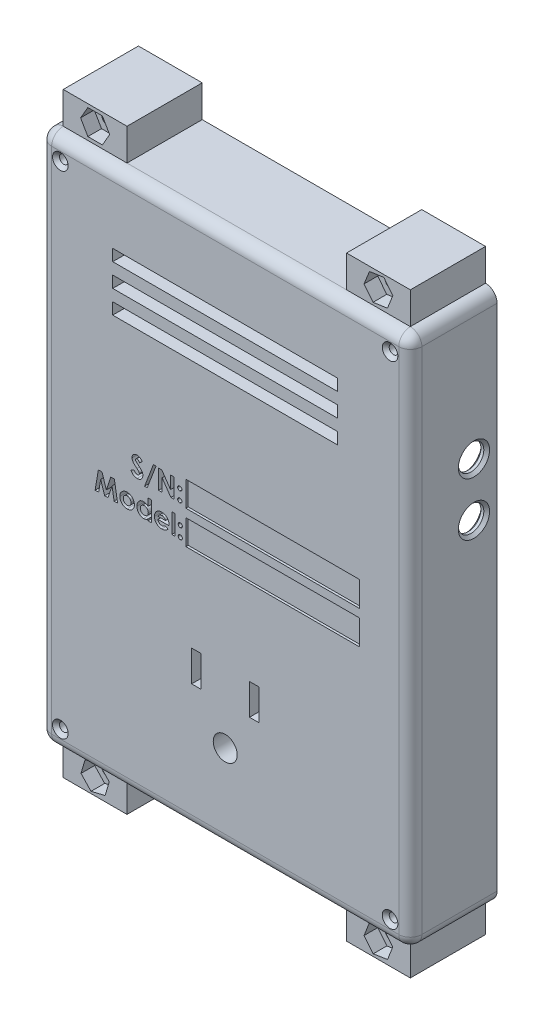
from build123d import *

# Parameters (mm, degrees)
SKETCH5_W                   = 81.28
SKETCH5_H                   = 116.84
CASE_2_DEPTH                = 12.7
CASE_CUT_DEPTH              = 7.366
SKETCH13_R                  = 2.159
BOARD_MOUNT_DEPTH           = 2.54
SKETCH11_R                  = 0.8255
BOARD_MOUNT_SCREW_CUT_DEPTH = 5.588
SKETCH8_R                   = 0.9525
FACEPLATE_SCREW_CUT_DEPTH   = 73.289667311
SKETCH14_R                  = 2.6289
SKETCH14_W                  = 2.032
SKETCH14_H                  = 6.8072
OUTLET_CUT_DEPTH            = 72.545537639
SKETCH24_W                  = 81.28
SKETCH24_H                  = 116.84
BOSS_EXTRUDE1_DEPTH         = 6.35
CUT_EXTRUDE1_START          = -6.35
CUT_EXTRUDE1_DEPTH          = 6.35
FILLET11_R                  = 2.54
FILLET12_R                  = 2.54
FILLET13_R                  = 2.54
SKETCH28_R                  = 0.9525
CUT_EXTRUDE3_DEPTH          = 73.289667311
FILLET14_R                  = 2.54
SKETCH30_W                  = 79.248
SKETCH30_H                  = 114.808
CUT_EXTRUDE4_DEPTH          = 2.032
FILLET15_R                  = 2.54
FILLET16_R                  = 2.54
FILLET17_R                  = 2.54
FILLET18_R                  = 2.54
SKETCH18_R                  = 2.794
CUT_EXTRUDE5_DEPTH          = 2.54
CHAMFER6_SIZE               = 0.635
FILLET19_R                  = 2.54
CHAMFER7_SIZE               = 0.762
SKETCH31_W                  = 38.071387925
SKETCH31_H                  = 5.512590528
SKETCH31_H_2                = 5.504700738
CUT_EXTRUDE6_DEPTH          = 0.508
SKETCH32_W                  = 0.75982906
SKETCH32_H                  = 4.341880342
CUT_EXTRUDE7_DEPTH          = 1.905
SKETCH33_W                  = 49.388401948
SKETCH33_H                  = 2.54
CUT_EXTRUDE8_DEPTH          = 27.94
SKETCH34_W                  = 14
SKETCH34_H                  = 16.51
BOSS_EXTRUDE2_DEPTH         = 7
SKETCH35_W                  = 14
SKETCH35_H                  = 16.51
BOSS_EXTRUDE3_DEPTH         = 7
SKETCH36_R                  = 1.575
CUT_EXTRUDE9_DEPTH          = 16.51
CUT_EXTRUDE10_DEPTH         = 3


with BuildPart() as part:
    # Sketch5 → Case 2 (new body)
    with BuildSketch(Plane.XY):
        Rectangle(SKETCH5_W, SKETCH5_H)
    extrude(amount=CASE_2_DEPTH)

    # Sketch4 → Case Cut (cut)
    with BuildSketch(Plane.XY):
        with BuildLine():
            Line((-36.195, 56.515), (36.195, 56.515))
            ThreePointArc((36.195, 56.515), (34.398948776, 52.178948776), (38.735, 53.975))
            Line((38.735, 53.975), (38.735, -53.975))
            ThreePointArc((38.735, -53.975), (34.398948776, -52.178948776), (36.195, -56.515))
            Line((36.195, -56.515), (-36.195, -56.515))
            ThreePointArc((-36.195, -56.515), (-34.398948776, -52.178948776), (-38.735, -53.975))
            Line((-38.735, -53.975), (-38.735, 53.975))
            ThreePointArc((-38.735, 53.975), (-34.398948776, 52.178948776), (-36.195, 56.515))
        make_face()
    extrude(amount=CASE_CUT_DEPTH, mode=Mode.SUBTRACT)

    # Sketch13 → Board Mount (add)
    with BuildSketch(Plane(origin=(0, 0, 7.366), x_dir=(-1, 0, 0), z_dir=(0, 0, -1))):
        with Locations(Location((-35.56, 48.641, 0), (0, 0, 180))):
            Circle(SKETCH13_R)
        with Locations(Location((35.56, 48.641, 0), (0, 0, 180))):
            Circle(SKETCH13_R)
        with Locations(Location((-35.56, -48.641, 0), (0, 0, 180))):
            Circle(SKETCH13_R)
        with Locations(Location((35.56, -48.641, 0), (0, 0, 180))):
            Circle(SKETCH13_R)
    extrude(amount=BOARD_MOUNT_DEPTH)

    # Sketch11 → Board Mount Screw Cut (cut)
    with BuildSketch(Plane(origin=(0, 0, 7.366), x_dir=(-1, 0, 0), z_dir=(0, 0, -1))):
        with Locations((-35.56, 48.641)):
            Circle(SKETCH11_R)
        with Locations((35.56, 48.641)):
            Circle(SKETCH11_R)
        with Locations((35.56, -48.641)):
            Circle(SKETCH11_R)
        with Locations((-35.56, -48.641)):
            Circle(SKETCH11_R)
    extrude(amount=BOARD_MOUNT_SCREW_CUT_DEPTH, mode=Mode.SUBTRACT)

    # Sketch8 → FacePlate Screw Cut (cut, through all)
    with BuildSketch(Plane.XY):
        with Locations((-36.195, 53.975)):
            Circle(SKETCH8_R)
        with Locations((-36.195, -53.975)):
            Circle(SKETCH8_R)
        with Locations((36.195, 53.975)):
            Circle(SKETCH8_R)
        with Locations((36.195, -53.975)):
            Circle(SKETCH8_R)
    extrude(amount=FACEPLATE_SCREW_CUT_DEPTH, mode=Mode.SUBTRACT)

    # Sketch14 → Outlet Cut (cut, through all)
    with BuildSketch(Plane(origin=(0, 0, 7.366), x_dir=(-1, 0, 0), z_dir=(0, 0, -1))):
        with Locations((0, -39.497)):
            Circle(SKETCH14_R)
        with Locations((-6.35, -27.559)):
            Rectangle(SKETCH14_W, SKETCH14_H)
        with Locations((6.35, -27.559)):
            Rectangle(SKETCH14_W, SKETCH14_H)
    extrude(amount=-OUTLET_CUT_DEPTH, mode=Mode.SUBTRACT)

    # Sketch24 → Boss-Extrude1 (add)
    with BuildSketch(Plane.XY):
        Rectangle(SKETCH24_W, SKETCH24_H)
    extrude(amount=-BOSS_EXTRUDE1_DEPTH)

    # Sketch26 → Cut-Extrude1 (cut)
    with BuildSketch(Plane.XY.offset(CUT_EXTRUDE1_START)):
        with BuildLine():
            Line((-36.195, 56.515), (36.195, 56.515))
            ThreePointArc((36.195, 56.515), (34.398948776, 52.178948776), (38.735, 53.975))
            Line((38.735, 53.975), (38.735, -53.975))
            ThreePointArc((38.735, -53.975), (34.398948776, -52.178948776), (36.195, -56.515))
            Line((36.195, -56.515), (-36.195, -56.515))
            ThreePointArc((-36.195, -56.515), (-34.398948776, -52.178948776), (-38.735, -53.975))
            Line((-38.735, -53.975), (-38.735, 53.975))
            ThreePointArc((-38.735, 53.975), (-34.398948776, 52.178948776), (-36.195, 56.515))
        make_face()
    extrude(amount=CUT_EXTRUDE1_DEPTH, mode=Mode.SUBTRACT)

    # Fillet11
    fillet11_edges = [part.edges().sort_by_distance(p)[0] for p in [
        (40.64, -58.42, 3.175),
    ]]
    fillet(fillet11_edges, radius=FILLET11_R)

    # Fillet12
    fillet12_edges = [part.edges().sort_by_distance(p)[0] for p in [
        (40.64, 58.42, 3.175),
    ]]
    fillet(fillet12_edges, radius=FILLET12_R)

    # Fillet13
    fillet13_edges = [part.edges().sort_by_distance(p)[0] for p in [
        (-40.64, 58.42, 3.175),
    ]]
    fillet(fillet13_edges, radius=FILLET13_R)

    # Sketch28 → Cut-Extrude3 (cut, through all)
    with BuildSketch(Plane(origin=(0, 0, 0), x_dir=(-1, 0, 0), z_dir=(0, 0, -1))):
        with Locations((-36.195, 53.975)):
            Circle(SKETCH28_R)
        with Locations((-36.195, -53.975)):
            Circle(SKETCH28_R)
        with Locations((36.195, 53.975)):
            Circle(SKETCH28_R)
        with Locations((36.195, -53.975)):
            Circle(SKETCH28_R)
    extrude(amount=CUT_EXTRUDE3_DEPTH, mode=Mode.SUBTRACT)

    # Fillet14
    fillet14_edges = [part.edges().sort_by_distance(p)[0] for p in [
        (-40.64, -58.42, 3.175),
    ]]
    fillet(fillet14_edges, radius=FILLET14_R)

    # Sketch30 → Cut-Extrude4 (cut)
    with BuildSketch(Plane(origin=(0, 0, -6.35), x_dir=(-1, 0, 0), z_dir=(0, 0, -1))):
        Rectangle(SKETCH30_W, SKETCH30_H)
    extrude(amount=-CUT_EXTRUDE4_DEPTH, mode=Mode.SUBTRACT)

    # Fillet15
    fillet15_edges = [part.edges().sort_by_distance(p)[0] for p in [
        (39.624, 57.404, -5.334),
    ]]
    fillet(fillet15_edges, radius=FILLET15_R)

    # Fillet16
    fillet16_edges = [part.edges().sort_by_distance(p)[0] for p in [
        (-39.624, 57.404, -5.334),
    ]]
    fillet(fillet16_edges, radius=FILLET16_R)

    # Fillet17
    fillet17_edges = [part.edges().sort_by_distance(p)[0] for p in [
        (-39.624, -57.404, -5.334),
    ]]
    fillet(fillet17_edges, radius=FILLET17_R)

    # Fillet18
    fillet18_edges = [part.edges().sort_by_distance(p)[0] for p in [
        (39.624, -57.404, -5.334),
    ]]
    fillet(fillet18_edges, radius=FILLET18_R)

    # Sketch18 → Cut-Extrude5 (cut)
    with BuildSketch(Plane(origin=(40.64, 0, 0), x_dir=(0, 0, -1), z_dir=(1, 0, 0))):
        with Locations((1.27, 28.829)):
            Circle(SKETCH18_R)
        with Locations((1.27, 17.145)):
            Circle(SKETCH18_R)
    extrude(amount=-CUT_EXTRUDE5_DEPTH, mode=Mode.SUBTRACT)

    # Chamfer6
    # the kernel refuses this chamfer: 0.635 mm, written as the material it takes off along each edge
    with BuildSketch(Plane(origin=(38.735, 28.829, -1.27), x_dir=(0, 0, -1), z_dir=(0, -1, 0))) as chamfer6_piece_1:
        Polygon((2.794, CHAMFER6_SIZE), (2.794 + CHAMFER6_SIZE, 0), (2.794, 0), align=None)
    revolve(axis=Axis((38.735, 28.829, -1.27), (1, 0, 0)), mode=Mode.SUBTRACT)
    with BuildSketch(Plane(origin=(40.64, 28.829, -1.27), x_dir=(0, 0, -1), z_dir=(0, -1, 0))) as chamfer6_piece_2:
        Polygon((2.794 + CHAMFER6_SIZE, 0), (2.794, -CHAMFER6_SIZE), (2.794, 0), align=None)
    revolve(axis=Axis((40.64, 28.829, -1.27), (1, 0, 0)), mode=Mode.SUBTRACT)
    with BuildSketch(Plane(origin=(38.735, 17.145, -1.27), x_dir=(0, 0, -1), z_dir=(0, -1, 0))) as chamfer6_piece_3:
        Polygon((2.794, CHAMFER6_SIZE), (2.794 + CHAMFER6_SIZE, 0), (2.794, 0), align=None)
    revolve(axis=Axis((38.735, 17.145, -1.27), (1, 0, 0)), mode=Mode.SUBTRACT)
    with BuildSketch(Plane(origin=(40.64, 17.145, -1.27), x_dir=(0, 0, -1), z_dir=(0, -1, 0))) as chamfer6_piece_4:
        Polygon((2.794 + CHAMFER6_SIZE, 0), (2.794, -CHAMFER6_SIZE), (2.794, 0), align=None)
    revolve(axis=Axis((40.64, 17.145, -1.27), (1, 0, 0)), mode=Mode.SUBTRACT)

    # Fillet19
    fillet19_edges = [part.edges().sort_by_distance(p)[0] for p in [
        (40.64, 0, 12.7),
        (39.896051224, -57.676051224, 12.7),
        (0, 58.42, 12.7),
        (39.896051224, 57.676051224, 12.7),
        (-40.64, 0, 12.7),
        (-39.896051224, 57.676051224, 12.7),
        (0, -58.42, 12.7),
        (-39.896051224, -57.676051224, 12.7),
    ]]
    fillet(fillet19_edges, radius=FILLET19_R)

    # Chamfer7
    chamfer7_edges = [part.edges().sort_by_distance(p)[0] for p in [
        (-37.1475, 53.975, 12.7),
        (-37.1475, -53.975, 12.7),
        (35.2425, 53.975, 12.7),
        (35.2425, -53.975, 12.7),
    ]]
    chamfer(chamfer7_edges, length=CHAMFER7_SIZE)

    # Sketch31 → Cut-Extrude6 (cut)
    with BuildSketch(Plane.XY.offset(12.7)):
        with Locations((10.393000027, 4.552836284)):
            Rectangle(SKETCH31_W, SKETCH31_H)
        with Locations((10.393000027, -2.752350369)):
            Rectangle(SKETCH31_W, SKETCH31_H_2)
    extrude(amount=-CUT_EXTRUDE6_DEPTH, mode=Mode.SUBTRACT)

    # Sketch32 → Cut-Extrude7 (cut)
    # profile 1 of 12: a face of its own
    with BuildSketch(Plane.XY.offset(12.7)):
        with BuildLine():
            Line((-18.191123097, 5.877144928), (-18.759298845, 5.35730652))
            add(Edge.make_bspline(
                [(-18.759298845, 5.35730652), (-18.783637058, 5.3916381), (-18.830363032, 5.457549944), (-18.906100963, 5.545807458), (-18.981496898, 5.621097685), (-19.057249335, 5.683106097), (-19.134029715, 5.731455949), (-19.211704758, 5.765688177), (-19.289834103, 5.78744993), (-19.342324962, 5.790159792), (-19.368179721, 5.791494554)],
                knots=[0, 0, 0, 0, 1.299362458, 2.494594718, 3.587462134, 4.587049575, 5.512617175, 6.380583204, 7.202344345, 8, 8, 8, 8], degree=3))
            add(Edge.make_bspline(
                [(-19.368179721, 5.791494554), (-19.392296298, 5.790648788), (-19.438859073, 5.789015835), (-19.505237763, 5.772784401), (-19.564169709, 5.744771331), (-19.615597397, 5.708141885), (-19.656335713, 5.664011895), (-19.688862099, 5.617730882), (-19.707177188, 5.56664711), (-19.709587814, 5.531560715), (-19.710781217, 5.514190869)],
                knots=[0, 0, 0, 0, 1.185010067, 2.2879431, 3.333075148, 4.379039566, 5.372662701, 6.27520591, 7.14612461, 8, 8, 8, 8], degree=3))
            add(Edge.make_bspline(
                [(-19.710781217, 5.514190869), (-19.710033372, 5.496570541), (-19.708527316, 5.461085649), (-19.693980864, 5.409078121), (-19.672055208, 5.358260713), (-19.651104348, 5.327325738), (-19.640395266, 5.311513251)],
                knots=[0, 0, 0, 0, 0.967525499, 1.948461899, 2.951351359, 4, 4, 4, 4], degree=3))
            add(Edge.make_bspline(
                [(-19.640395266, 5.311513251), (-19.630659552, 5.29922237), (-19.608249223, 5.270930386), (-19.565517316, 5.226120294), (-19.511855016, 5.171224009), (-19.445197284, 5.108129253), (-19.368311265, 5.034566892), (-19.277633194, 4.95342869), (-19.175773181, 4.862201892), (-19.103373444, 4.798674854), (-19.06543533, 4.765386114)],
                knots=[0, 0, 0, 0, 0.473873513, 1.090794244, 1.870441696, 2.795289791, 3.865433203, 5.087734844, 6.473946851, 8, 8, 8, 8], degree=3))
            add(Edge.make_bspline(
                [(-19.06543533, 4.765386114), (-19.029824953, 4.734567129), (-18.962243855, 4.676079098), (-18.866089373, 4.593064728), (-18.781585599, 4.518378724), (-18.707501503, 4.453141963), (-18.64496013, 4.396669961), (-18.593698554, 4.348692783), (-18.553090703, 4.310144456), (-18.530007518, 4.286861243), (-18.520156217, 4.276924576)],
                knots=[0, 0, 0, 0, 1.543621617, 2.929473131, 4.163658386, 5.240097082, 6.164993805, 6.925417477, 7.541396219, 8, 8, 8, 8], degree=3))
            add(Edge.make_bspline(
                [(-18.520156217, 4.276924576), (-18.482782434, 4.236478138), (-18.410936897, 4.158725881), (-18.317563027, 4.038234335), (-18.240713312, 3.920610017), (-18.181260915, 3.803639635), (-18.136360074, 3.685635539), (-18.104704386, 3.563703686), (-18.085745583, 3.436569964), (-18.083640714, 3.349816718), (-18.082576089, 3.305937663)],
                knots=[0, 0, 0, 0, 1.206664779, 2.319633467, 3.337109185, 4.282041471, 5.190008762, 6.099243693, 7.03861361, 8, 8, 8, 8], degree=3))
            add(Edge.make_bspline(
                [(-18.082576089, 3.305937663), (-18.083333861, 3.263182906), (-18.08482064, 3.179296481), (-18.103030829, 3.056541193), (-18.128997489, 2.939059055), (-18.1691465, 2.828128438), (-18.218079878, 2.721928451), (-18.279424934, 2.622113351), (-18.351466291, 2.527672968), (-18.434036748, 2.440295541), (-18.525369477, 2.361006582), (-18.62333251, 2.290421678), (-18.728883778, 2.232144849), (-18.841121467, 2.184158037), (-18.959985499, 2.147197952), (-19.085334271, 2.119881006), (-19.217359513, 2.103485805), (-19.307640277, 2.101771881), (-19.353763321, 2.100896264)],
                knots=[0, 0, 0, 0, 1.043214005, 2.046824704, 3.02475056, 3.976699089, 4.921714032, 5.875962561, 6.831408892, 7.817874052, 8.806269674, 9.781291748, 10.760897367, 11.74438705, 12.757449933, 13.795994037, 14.874007457, 16, 16, 16, 16], degree=3))
            add(Edge.make_bspline(
                [(-19.353763321, 2.100896264), (-19.389969519, 2.101538586), (-19.461678554, 2.102810752), (-19.567366831, 2.113196929), (-19.66942081, 2.129959113), (-19.767725536, 2.153984331), (-19.862723889, 2.184427541), (-19.954419771, 2.221612755), (-20.042180175, 2.266116331), (-20.126669137, 2.317023097), (-20.207475937, 2.376132559), (-20.285622345, 2.442236243), (-20.360332136, 2.516350852), (-20.431964128, 2.598301108), (-20.500059997, 2.688319076), (-20.566848767, 2.785151087), (-20.629362144, 2.890594214), (-20.667979437, 2.96456342), (-20.687704294, 3.002345249)],
                knots=[0, 0, 0, 0, 1.016823716, 2.013894106, 2.979844003, 3.91962641, 4.853723003, 5.779685073, 6.695824784, 7.614987388, 8.547259901, 9.504950863, 10.487499108, 11.500346958, 12.559593716, 13.656357062, 14.802919212, 16, 16, 16, 16], degree=3))
            Line((-20.687704294, 3.002345249), (-20.019461772, 3.403460366))
            add(Edge.make_bspline(
                [(-20.019461772, 3.403460366), (-19.994788925, 3.360573054), (-19.947488968, 3.278354412), (-19.86733477, 3.167883246), (-19.785220886, 3.073282978), (-19.699248916, 2.996225674), (-19.610464248, 2.93568098), (-19.518438031, 2.892411542), (-19.423105609, 2.865627808), (-19.358169495, 2.862356896), (-19.325778546, 2.860725324)],
                knots=[0, 0, 0, 0, 1.283663364, 2.460892379, 3.537111102, 4.529833553, 5.449777664, 6.316464042, 7.160231139, 8, 8, 8, 8], degree=3))
            add(Edge.make_bspline(
                [(-19.325778546, 2.860725324), (-19.292832314, 2.862057754), (-19.228911825, 2.864642863), (-19.137673506, 2.888520734), (-19.054022761, 2.926010744), (-18.981715675, 2.979503818), (-18.920490593, 3.041242955), (-18.875302969, 3.109930569), (-18.846915798, 3.184248909), (-18.843914586, 3.235875316), (-18.842405148, 3.261840441)],
                knots=[0, 0, 0, 0, 1.13588714, 2.203786484, 3.234766741, 4.283437687, 5.291419208, 6.222934724, 7.106237994, 8, 8, 8, 8], degree=3))
            add(Edge.make_bspline(
                [(-18.842405148, 3.261840441), (-18.843799052, 3.285996764), (-18.846630635, 3.335068022), (-18.867487199, 3.408029092), (-18.90009237, 3.480956981), (-18.938666586, 3.540774409), (-18.977920682, 3.590857919), (-19.015456451, 3.634253015), (-19.061165088, 3.682197), (-19.114930696, 3.734750182), (-19.176042892, 3.792375201), (-19.244553154, 3.855066414), (-19.321245998, 3.922271587), (-19.375452651, 3.968051086), (-19.403796708, 3.991988678)],
                knots=[0, 0, 0, 0, 0.916159276, 1.861089862, 2.860218735, 3.940849679, 4.552606315, 5.27541173, 6.11797699, 7.06649574, 8.129236253, 9.306560635, 10.591630461, 12, 12, 12, 12], degree=3))
            add(Edge.make_bspline(
                [(-19.403796708, 3.991988678), (-19.457679889, 4.037579016), (-19.561098022, 4.125080674), (-19.707240965, 4.254317867), (-19.838928842, 4.375101866), (-19.955024255, 4.488925826), (-20.057006439, 4.59368768), (-20.144184727, 4.690238346), (-20.215601426, 4.779322579), (-20.290752102, 4.884836891), (-20.362160269, 5.013413331), (-20.42387719, 5.168105694), (-20.463916523, 5.322778428), (-20.468402374, 5.426617183), (-20.470610277, 5.477725858)],
                knots=[0, 0, 0, 0, 1.345494975, 2.582412109, 3.71882943, 4.751509156, 5.681369928, 6.505683931, 7.230279997, 7.856715994, 8.973648664, 10.023341002, 11.027102913, 12, 12, 12, 12], degree=3))
            add(Edge.make_bspline(
                [(-20.470610277, 5.477725858), (-20.469692013, 5.513969387), (-20.467882934, 5.585373032), (-20.451745677, 5.690361689), (-20.42762793, 5.791666921), (-20.392602038, 5.888919121), (-20.347142659, 5.981996477), (-20.29193401, 6.071354641), (-20.226118803, 6.156171181), (-20.151949509, 6.236389869), (-20.070233936, 6.309700622), (-19.982910462, 6.374404707), (-19.890473345, 6.429054718), (-19.793488069, 6.47439087), (-19.691353656, 6.509092815), (-19.584822526, 6.533691283), (-19.47374188, 6.548321668), (-19.398187222, 6.550310499), (-19.359699486, 6.551323614)],
                knots=[0, 0, 0, 0, 1.010766082, 1.991317756, 2.957454644, 3.913069143, 4.869106762, 5.843196583, 6.838735724, 7.860187025, 8.887984031, 9.89767229, 10.887916223, 11.879572884, 12.879850636, 13.892031539, 14.926195476, 16, 16, 16, 16], degree=3))
            add(Edge.make_bspline(
                [(-19.359699486, 6.551323614), (-19.309821285, 6.549498963), (-19.210458604, 6.545864065), (-19.063548015, 6.517440346), (-18.920051894, 6.472741054), (-18.80442003, 6.418816276), (-18.712413914, 6.366579318), (-18.641899821, 6.318486107), (-18.570147936, 6.263392749), (-18.496579624, 6.201125631), (-18.422561899, 6.130511557), (-18.345990082, 6.053231552), (-18.267907559, 5.968617736), (-18.217166299, 5.908170018), (-18.191123097, 5.877144928)],
                knots=[0, 0, 0, 0, 1.282922637, 2.555718331, 3.837320111, 5.142675274, 5.830281639, 6.55870424, 7.337177975, 8.157850921, 9.037902056, 9.96903443, 10.957596896, 12, 12, 12, 12], degree=3))
        make_face()
    # profile 2 of 12: a face of its own
    with BuildSketch(Plane.XY.offset(12.7)):
        Polygon((-17.702661559, 1.449614213), (-15.754751569, 6.551323614), (-15.17894361, 6.551323614), (-17.126853599, 1.449614213), align=None)
    # profile 3 of 12: a face of its own
    with BuildSketch(Plane.XY.offset(12.7)):
        Polygon((-14.609071815, 6.442776606), (-13.924716847, 6.442776606), (-12.00394361, 3.657019394), (-12.00394361, 6.442776606), (-11.24411455, 6.442776606), (-11.24411455, 2.209443272), (-11.933557659, 2.209443272), (-13.849242755, 4.986720249), (-13.849242755, 2.209443272), (-14.609071815, 2.209443272), align=None)
    # profile 4 of 12: a face of its own
    with BuildSketch(Plane.XY.offset(12.7)):
        with BuildLine():
            add(Edge.make_bspline(
                [(-9.9686872, 5.35730652), (-9.937984768, 5.355718732), (-9.87745762, 5.352588546), (-9.790545469, 5.326478209), (-9.711335748, 5.282486162), (-9.641172065, 5.223512547), (-9.581903266, 5.153199943), (-9.538407615, 5.073439373), (-9.511958455, 4.986110206), (-9.508913781, 4.925280522), (-9.507362413, 4.894285687)],
                knots=[0, 0, 0, 0, 1.013817282, 1.998651736, 2.969187861, 3.991244904, 5.013301947, 5.9920405, 6.976874954, 8, 8, 8, 8], degree=3))
            add(Edge.make_bspline(
                [(-9.507362413, 4.894285687), (-9.508893514, 4.863843269), (-9.511898432, 4.804097377), (-9.538799386, 4.718083569), (-9.581866264, 4.638752833), (-9.641182178, 4.568453843), (-9.711333192, 4.509476568), (-9.790546146, 4.465485454), (-9.877457444, 4.439374871), (-9.937984709, 4.436244719), (-9.9686872, 4.434656948)],
                knots=[0, 0, 0, 0, 1.009116963, 1.980479832, 2.963706907, 3.990451133, 5.017195359, 5.992182391, 6.981533323, 8, 8, 8, 8], degree=3))
            add(Edge.make_bspline(
                [(-9.9686872, 4.434656948), (-9.99940554, 4.436214655), (-10.059964051, 4.43928554), (-10.146757405, 4.465862547), (-10.226762822, 4.508213247), (-10.296884149, 4.566824871), (-10.356742443, 4.636055979), (-10.398546924, 4.716040624), (-10.425601169, 4.802663802), (-10.428518728, 4.863267593), (-10.430011986, 4.894285687)],
                knots=[0, 0, 0, 0, 1.016706445, 2.004347467, 2.981433789, 4.000427929, 5.018214116, 5.995300439, 6.973959266, 8, 8, 8, 8], degree=3))
            add(Edge.make_bspline(
                [(-10.430011986, 4.894285687), (-10.428481289, 4.92529182), (-10.425477182, 4.986143677), (-10.398772747, 5.073182383), (-10.35649654, 5.15345188), (-10.296961165, 5.223440376), (-10.226780242, 5.282779937), (-10.146985625, 5.326258075), (-10.059938403, 5.352626918), (-9.999396909, 5.355731645), (-9.9686872, 5.35730652)],
                knots=[0, 0, 0, 0, 1.022642663, 2.007012786, 2.980863166, 4.002438329, 5.024013493, 6.00229059, 6.986660713, 8, 8, 8, 8], degree=3))
        make_face()
    # profile 5 of 12: a face of its own
    with BuildSketch(Plane.XY.offset(12.7)):
        with BuildLine():
            add(Edge.make_bspline(
                [(-9.9686872, 3.077819341), (-9.938013801, 3.076137592), (-9.877623178, 3.072826519), (-9.790366961, 3.048116329), (-9.711617723, 3.003720953), (-9.641205382, 2.945814879), (-9.581666479, 2.87614614), (-9.538633107, 2.796697462), (-9.511835147, 2.709777455), (-9.508876633, 2.649196835), (-9.507362413, 2.618190601)],
                knots=[0, 0, 0, 0, 1.016957001, 2.002212695, 2.9757545, 3.99499976, 5.013036768, 5.994806404, 6.97370641, 8, 8, 8, 8], degree=3))
            add(Edge.make_bspline(
                [(-9.507362413, 2.618190601), (-9.508866713, 2.587179388), (-9.511805846, 2.526589038), (-9.538818546, 2.439499662), (-9.581602174, 2.359397988), (-9.641210159, 2.288982703), (-9.711326121, 2.229985335), (-9.790548019, 2.185999349), (-9.877456956, 2.159887412), (-9.937984545, 2.156757446), (-9.9686872, 2.155169768)],
                knots=[0, 0, 0, 0, 1.023218912, 1.999186227, 2.986238111, 4.008388923, 5.030539734, 6.0011649, 6.986089706, 8, 8, 8, 8], degree=3))
            add(Edge.make_bspline(
                [(-9.9686872, 2.155169768), (-9.99939713, 2.156744535), (-10.05993906, 2.15984905), (-10.146983091, 2.186219446), (-10.226789867, 2.229691667), (-10.296923446, 2.289054267), (-10.356797733, 2.359148641), (-10.398364982, 2.439752397), (-10.425629298, 2.526556205), (-10.428528251, 2.587168272), (-10.430011986, 2.618190601)],
                knots=[0, 0, 0, 0, 1.013427518, 1.99788335, 2.976245624, 3.997909735, 5.019573847, 6.001765691, 6.977268297, 8, 8, 8, 8], degree=3))
            add(Edge.make_bspline(
                [(-10.430011986, 2.618190601), (-10.428518462, 2.649208145), (-10.425600384, 2.70981086), (-10.398549893, 2.796441816), (-10.356731114, 2.876396841), (-10.296928439, 2.945743166), (-10.226496763, 3.004012328), (-10.147165165, 3.047899247), (-10.059772922, 3.072865165), (-9.999367907, 3.076150609), (-9.9686872, 3.077819341)],
                knots=[0, 0, 0, 0, 1.025808215, 2.00424526, 2.981110158, 3.998665696, 5.017428914, 5.998734231, 6.983523959, 8, 8, 8, 8], degree=3))
        make_face()
    # profile 6 of 12: a face of its own
    with BuildSketch(Plane.XY.offset(12.7)):
        Polygon((-27.846040786, -0.50739833), (-27.057378927, -0.50739833), (-26.091480156, -3.460216172), (-25.118797197, -0.50739833), (-24.337767549, -0.50739833), (-23.622035711, -4.740731663), (-24.39119303, -4.740731663), (-24.843189558, -2.066913554), (-25.723437955, -4.740731663), (-26.464610498, -4.740731663), (-27.339770754, -2.066913554), (-27.790919258, -4.740731663), (-28.5609246, -4.740731663), align=None)
    # profile 7 of 12: a face of its own
    with BuildSketch(Plane.XY.offset(12.7)):
        with BuildLine():
            add(Edge.make_bspline(
                [(-21.551162314, -1.592868415), (-21.515239063, -1.593507694), (-21.444094748, -1.594773756), (-21.338134179, -1.605312564), (-21.234026045, -1.622507064), (-21.131171946, -1.64477094), (-21.030526979, -1.67596596), (-20.931563274, -1.713379563), (-20.833395968, -1.756334754), (-20.738461555, -1.807466457), (-20.646074204, -1.862923452), (-20.558485498, -1.924097067), (-20.476422799, -1.990506806), (-20.398362745, -2.060612905), (-20.32794306, -2.137467555), (-20.260663549, -2.217367578), (-20.200159159, -2.303175512), (-20.14414081, -2.392800416), (-20.094268076, -2.485724008), (-20.050962779, -2.581299876), (-20.013377853, -2.678206618), (-19.983949609, -2.777624624), (-19.959585736, -2.878242935), (-19.9442104, -2.981294553), (-19.933279602, -3.085720881), (-19.932053913, -3.156029277), (-19.931437421, -3.191392721)],
                knots=[0, 0, 0, 0, 1.022364134, 2.024744242, 3.027414945, 4.024939316, 5.017584196, 6.023349371, 7.035562955, 8.064994934, 9.090267829, 10.101425541, 11.102933353, 12.093946398, 13.084502048, 14.067315274, 15.065326281, 16.070028806, 17.074376865, 18.064572984, 19.055292013, 20.030201733, 21.013838017, 21.999348303, 22.993720005, 24, 24, 24, 24], degree=3))
            add(Edge.make_bspline(
                [(-19.931437421, -3.191392721), (-19.932088026, -3.227032441), (-19.933381577, -3.297892285), (-19.943814937, -3.40330087), (-19.961075252, -3.506837093), (-19.983424577, -3.609110901), (-20.014502857, -3.708813605), (-20.050814509, -3.80741486), (-20.095388491, -3.903570696), (-20.144668312, -3.998330081), (-20.201046836, -4.088904537), (-20.261498852, -4.175572059), (-20.328496564, -4.256058952), (-20.39835252, -4.332861338), (-20.474380145, -4.403382103), (-20.555365899, -4.468766318), (-20.640608667, -4.529813333), (-20.730721437, -4.585090871), (-20.824550014, -4.633661272), (-20.920511996, -4.677451452), (-21.019168516, -4.713909903), (-21.120315399, -4.743640767), (-21.224013986, -4.76666063), (-21.33003534, -4.782298297), (-21.438151127, -4.793174114), (-21.510995288, -4.794390887), (-21.54777022, -4.795005167)],
                knots=[0, 0, 0, 0, 1.012026251, 2.012137606, 3.004615893, 3.992048833, 4.982446996, 5.968083444, 6.973977695, 7.990229942, 8.999482246, 10.001782172, 10.988562221, 11.971415814, 12.948383116, 13.930088534, 14.925840678, 15.924049238, 16.929462851, 17.924729459, 18.917889337, 19.913673841, 20.916777188, 21.931792057, 22.95587778, 24, 24, 24, 24], degree=3))
            add(Edge.make_bspline(
                [(-21.54777022, -4.795005167), (-21.60154267, -4.79342684), (-21.707528987, -4.790315933), (-21.863621774, -4.769007031), (-22.013575415, -4.732328824), (-22.157634258, -4.681200213), (-22.295985439, -4.615680802), (-22.427421539, -4.534590582), (-22.553249989, -4.439525987), (-22.671291347, -4.331290511), (-22.779433221, -4.212546392), (-22.873908159, -4.085787768), (-22.954125027, -3.952914539), (-23.020011653, -3.813775184), (-23.070862693, -3.668178905), (-23.107585821, -3.516560985), (-23.128920775, -3.358495247), (-23.132005371, -3.251100824), (-23.133574173, -3.196480862)],
                knots=[0, 0, 0, 0, 1.029999031, 2.030143771, 3.011211297, 3.982305373, 4.953580601, 5.938004764, 6.935448627, 7.970290061, 9.001484052, 10.007591832, 10.993831261, 11.969999897, 12.951306496, 13.942897864, 14.953773953, 16, 16, 16, 16], degree=3))
            add(Edge.make_bspline(
                [(-23.133574173, -3.196480862), (-23.131950663, -3.138158715), (-23.128759685, -3.023527704), (-23.103421921, -2.855590659), (-23.062960246, -2.694798898), (-23.00488006, -2.541602206), (-22.93068773, -2.395718032), (-22.840115709, -2.257454062), (-22.732716386, -2.126778977), (-22.65047001, -2.047742206), (-22.608647624, -2.007551909)],
                knots=[0, 0, 0, 0, 1.043912699, 2.05178951, 3.033892, 4.007821512, 4.978932272, 5.95884105, 6.962068106, 8, 8, 8, 8], degree=3))
            add(Edge.make_bspline(
                [(-22.608647624, -2.007551909), (-22.570271405, -1.974238673), (-22.494563068, -1.908518555), (-22.371561939, -1.825163359), (-22.245622662, -1.753169901), (-22.115235801, -1.693977887), (-21.980037872, -1.649348064), (-21.840721686, -1.616861546), (-21.697316213, -1.596907375), (-21.600127859, -1.594221577), (-21.551162314, -1.592868415)],
                knots=[0, 0, 0, 0, 1.048115528, 2.067714963, 3.060638214, 4.039924844, 5.017819947, 5.994373833, 6.98952318, 8, 8, 8, 8], degree=3))
        make_face()
        with BuildLine():
            add(Edge.make_bspline(
                [(-21.534201844, -2.298423971), (-21.56362034, -2.299401744), (-21.621530966, -2.301326502), (-21.706776929, -2.311656161), (-21.787403459, -2.332827684), (-21.865011949, -2.359752067), (-21.938229496, -2.395759635), (-22.009061269, -2.437896789), (-22.073824171, -2.490626251), (-22.135652287, -2.548466613), (-22.191778434, -2.612696784), (-22.239603241, -2.682675506), (-22.282335766, -2.755725542), (-22.314737673, -2.834521343), (-22.341553348, -2.916909192), (-22.359701875, -3.004220226), (-22.372331983, -3.095479133), (-22.373269589, -3.157992109), (-22.373745113, -3.189696674)],
                knots=[0, 0, 0, 0, 1.030650113, 2.02884584, 2.99876339, 3.944280128, 4.900564847, 5.851248946, 6.823638398, 7.81794922, 8.81432732, 9.802856497, 10.78262424, 11.771747962, 12.779760563, 13.812642396, 14.89064281, 16, 16, 16, 16], degree=3))
            add(Edge.make_bspline(
                [(-22.373745113, -3.189696674), (-22.373188686, -3.222519301), (-22.372101255, -3.286664822), (-22.360840683, -3.380325909), (-22.342271628, -3.46920966), (-22.31589082, -3.553178768), (-22.2827125, -3.632835954), (-22.242006549, -3.707734287), (-22.193343361, -3.777423431), (-22.138171117, -3.841817571), (-22.077759866, -3.900268844), (-22.011565941, -3.95042954), (-21.942361292, -3.994012527), (-21.868551071, -4.029016392), (-21.791183592, -4.056042216), (-21.710029185, -4.075940422), (-21.624661383, -4.08666061), (-21.566454033, -4.088507161), (-21.536745914, -4.089449612)],
                knots=[0, 0, 0, 0, 1.141730614, 2.231293227, 3.276944405, 4.297399982, 5.28939179, 6.275415646, 7.257752684, 8.24146775, 9.222424823, 10.176631434, 11.126518621, 12.063689483, 13.012557477, 13.974037417, 14.965980454, 16, 16, 16, 16], degree=3))
            add(Edge.make_bspline(
                [(-21.536745914, -4.089449612), (-21.507022937, -4.088613701), (-21.448748647, -4.086974829), (-21.363280596, -4.074702272), (-21.281711755, -4.055387685), (-21.203683498, -4.028129259), (-21.12982669, -3.992376154), (-21.059858602, -3.948584661), (-20.993163715, -3.897726275), (-20.93194174, -3.838172137), (-20.875269728, -3.773577175), (-20.825571763, -3.703520146), (-20.784042269, -3.628621795), (-20.749980648, -3.549353381), (-20.723548125, -3.465823859), (-20.705286485, -3.377722761), (-20.692649624, -3.285323118), (-20.691733222, -3.221965818), (-20.691266481, -3.189696674)],
                knots=[0, 0, 0, 0, 1.031504075, 2.022346795, 2.991027682, 3.937587355, 4.885570121, 5.833146507, 6.798790848, 7.791235734, 8.792807298, 9.778388351, 10.766749885, 11.760164525, 12.768777521, 13.802286646, 14.880660483, 16, 16, 16, 16], degree=3))
            add(Edge.make_bspline(
                [(-20.691266481, -3.189696674), (-20.691829987, -3.157438808), (-20.692935768, -3.09413841), (-20.704197143, -3.001613798), (-20.722583966, -2.913797467), (-20.749305028, -2.831064386), (-20.782286141, -2.752470701), (-20.823020228, -2.678418705), (-20.871923407, -2.609273122), (-20.927363859, -2.545376815), (-20.988680712, -2.487745746), (-21.053725352, -2.436352822), (-21.123985149, -2.393846926), (-21.198141987, -2.358806895), (-21.276393162, -2.331848592), (-21.358650825, -2.311837619), (-21.44516707, -2.301269974), (-21.504213412, -2.299382553), (-21.534201844, -2.298423971)],
                knots=[0, 0, 0, 0, 1.123894411, 2.205445421, 3.243160173, 4.246488011, 5.231014757, 6.210004299, 7.185865357, 8.177612767, 9.153374344, 10.115157457, 11.061423229, 12.009021698, 12.96873347, 13.94135618, 14.954456845, 16, 16, 16, 16], degree=3))
        make_face(mode=Mode.SUBTRACT)
    # profile 8 of 12: a face of its own
    with BuildSketch(Plane.XY.offset(12.7)):
        with BuildLine():
            Line((-16.946394686, -0.398851321), (-16.186565626, -0.398851321))
            Line((-16.186565626, -0.398851321), (-16.186565626, -4.740731663))
            Line((-16.186565626, -4.740731663), (-16.946394686, -4.740731663))
            Line((-16.946394686, -4.740731663), (-16.946394686, -4.403218308))
            add(Edge.make_bspline(
                [(-16.946394686, -4.403218308), (-16.984043936, -4.436071498), (-17.057113695, -4.499833051), (-17.172247992, -4.582565288), (-17.287718724, -4.65080869), (-17.404080732, -4.705160839), (-17.523122451, -4.745294306), (-17.645700933, -4.774351874), (-17.77358144, -4.791487833), (-17.860512847, -4.79382051), (-17.904661246, -4.795005167)],
                knots=[0, 0, 0, 0, 1.129196829, 2.191548051, 3.199897424, 4.157751732, 5.089409408, 6.034969131, 7.002052659, 8, 8, 8, 8], degree=3))
            add(Edge.make_bspline(
                [(-17.904661246, -4.795005167), (-17.954219786, -4.793890255), (-18.05215027, -4.791687126), (-18.195852383, -4.768495632), (-18.334611059, -4.732995882), (-18.468313666, -4.682759299), (-18.596716943, -4.617662535), (-18.720803565, -4.539404057), (-18.838446309, -4.445236524), (-18.95062451, -4.339234325), (-19.053334198, -4.222631151), (-19.143123977, -4.09704544), (-19.218810088, -3.964258346), (-19.280815668, -3.824710121), (-19.329591064, -3.678503184), (-19.364360942, -3.525173813), (-19.38487521, -3.364667245), (-19.387414299, -3.255336456), (-19.388702378, -3.199872956)],
                knots=[0, 0, 0, 0, 0.980476535, 1.937477201, 2.874147792, 3.812856188, 4.758993464, 5.720109578, 6.712210464, 7.737600662, 8.772720504, 9.783789959, 10.789002326, 11.793715968, 12.802552247, 13.835794126, 14.902098527, 16, 16, 16, 16], degree=3))
            add(Edge.make_bspline(
                [(-19.388702378, -3.199872956), (-19.387350534, -3.142440428), (-19.384698741, -3.029780126), (-19.365301036, -2.864456489), (-19.331172793, -2.707325328), (-19.28463648, -2.558168995), (-19.224775595, -2.41696172), (-19.151869036, -2.28347216), (-19.064924978, -2.158049238), (-18.964737365, -2.042827737), (-18.85655935, -1.937221667), (-18.740827998, -1.845283208), (-18.619353094, -1.767177209), (-18.492005551, -1.703412403), (-18.358803553, -1.654138188), (-18.220272981, -1.618114714), (-18.075798855, -1.596499364), (-17.97738191, -1.594088783), (-17.92755788, -1.592868415)],
                knots=[0, 0, 0, 0, 1.136281865, 2.228943489, 3.287578264, 4.313574083, 5.316051562, 6.317280042, 7.318008486, 8.329309503, 9.333984563, 10.305318864, 11.248632312, 12.186624717, 13.117503092, 14.05354244, 15.014596925, 16, 16, 16, 16], degree=3))
            add(Edge.make_bspline(
                [(-17.92755788, -1.592868415), (-17.881434439, -1.594331766), (-17.790225331, -1.597225542), (-17.655493768, -1.615441139), (-17.525856416, -1.64973952), (-17.399738834, -1.693930462), (-17.278778901, -1.753396397), (-17.162326753, -1.824829221), (-17.050075558, -1.909136112), (-16.98139189, -1.974331918), (-16.946394686, -2.007551909)],
                knots=[0, 0, 0, 0, 1.011899165, 2.001030639, 2.974036179, 3.948778736, 4.92769327, 5.924124564, 6.942254589, 8, 8, 8, 8], degree=3))
            Line((-16.946394686, -2.007551909), (-16.946394686, -0.398851321))
        make_face()
        with BuildLine():
            add(Edge.make_bspline(
                [(-17.768129461, -2.298423971), (-17.79840641, -2.299352972), (-17.857747251, -2.301173754), (-17.94501608, -2.312125884), (-18.0284189, -2.331424025), (-18.10736089, -2.359932884), (-18.183018575, -2.394660828), (-18.254243082, -2.438157006), (-18.321622248, -2.489568564), (-18.384759809, -2.54765083), (-18.442318998, -2.611493859), (-18.491938379, -2.681160437), (-18.534106836, -2.754773444), (-18.569770391, -2.83255421), (-18.595297405, -2.915423121), (-18.61551479, -3.002301372), (-18.626006304, -3.093898714), (-18.627908085, -3.156319468), (-18.628873318, -3.188000627)],
                knots=[0, 0, 0, 0, 1.04836806, 2.054732945, 3.03993516, 4.00574415, 4.955904794, 5.917688631, 6.888591924, 7.88601754, 8.884115178, 9.859153345, 10.841239365, 11.818093293, 12.814750328, 13.83810466, 14.90274714, 16, 16, 16, 16], degree=3))
            add(Edge.make_bspline(
                [(-18.628873318, -3.188000627), (-18.627922829, -3.219969152), (-18.6260499, -3.282962761), (-18.615345152, -3.37533276), (-18.595855273, -3.463480098), (-18.567420273, -3.546692165), (-18.532694543, -3.626091768), (-18.49042552, -3.701312468), (-18.438505428, -3.771024271), (-18.380895782, -3.836876791), (-18.316462964, -3.895680536), (-18.24870254, -3.947892862), (-18.176688955, -3.991578882), (-18.101203507, -4.0268862), (-18.022500282, -4.055658696), (-17.939592581, -4.074714299), (-17.853292589, -4.086896185), (-17.794459606, -4.088592592), (-17.764737367, -4.089449612)],
                knots=[0, 0, 0, 0, 1.099136573, 2.165835871, 3.191374663, 4.196217796, 5.183857741, 6.167377911, 7.154730987, 8.166690795, 9.170734848, 10.148332609, 11.103258353, 12.059567475, 13.009337315, 13.978056681, 14.978520572, 16, 16, 16, 16], degree=3))
            add(Edge.make_bspline(
                [(-17.764737367, -4.089449612), (-17.733896476, -4.088515402), (-17.673431562, -4.086683844), (-17.584738987, -4.075831664), (-17.500215768, -4.056462765), (-17.420213566, -4.027790686), (-17.343510425, -3.99331202), (-17.27079852, -3.95066579), (-17.202866887, -3.899372207), (-17.139371482, -3.840764877), (-17.081190184, -3.776400531), (-17.030884606, -3.705820387), (-16.987066608, -3.631281792), (-16.952605768, -3.551022381), (-16.925239029, -3.46644632), (-16.905604025, -3.377028712), (-16.894923721, -3.282673154), (-16.893067173, -3.218271809), (-16.892121182, -3.185456556)],
                knots=[0, 0, 0, 0, 1.050008698, 2.058587853, 3.036635738, 3.995319155, 4.947022481, 5.895997462, 6.858296291, 7.838991643, 8.833936038, 9.806048392, 10.784806122, 11.771666913, 12.772873988, 13.80724452, 14.882696879, 16, 16, 16, 16], degree=3))
            add(Edge.make_bspline(
                [(-16.892121182, -3.185456556), (-16.893055418, -3.153205711), (-16.894880252, -3.090210441), (-16.905650086, -2.997824982), (-16.925424488, -2.910163128), (-16.952227974, -2.827063744), (-16.987301883, -2.748716836), (-17.031153035, -2.675991084), (-17.080906789, -2.606366815), (-17.139732239, -2.543741306), (-17.202883675, -2.485558337), (-17.271814353, -2.43581591), (-17.344352582, -2.392946505), (-17.42094404, -2.357749071), (-17.502297928, -2.331948017), (-17.586965592, -2.311971205), (-17.676268023, -2.301180327), (-17.73700929, -2.29935775), (-17.768129461, -2.298423971)],
                knots=[0, 0, 0, 0, 1.106611376, 2.161533483, 3.185006901, 4.184773755, 5.152708835, 6.122342771, 7.094156588, 8.082475533, 9.064254463, 10.03606828, 10.992420271, 11.951521816, 12.920622147, 13.915721683, 14.932141191, 16, 16, 16, 16], degree=3))
        make_face(mode=Mode.SUBTRACT)
    # profile 9 of 12: a face of its own
    with BuildSketch(Plane.XY.offset(12.7)):
        with BuildLine():
            Line((-12.335690893, -3.383894056), (-14.775454515, -3.383894056))
            add(Edge.make_bspline(
                [(-14.775454515, -3.383894056), (-14.770480034, -3.412242725), (-14.760704786, -3.467950097), (-14.739477488, -3.548869888), (-14.712388273, -3.625127333), (-14.679923554, -3.69682437), (-14.642630686, -3.764340033), (-14.599131646, -3.827357646), (-14.549978179, -3.88582155), (-14.495454477, -3.939477652), (-14.436469351, -3.987554683), (-14.373308857, -4.029673202), (-14.305907818, -4.06420781), (-14.235038961, -4.093316901), (-14.160172733, -4.116374251), (-14.08119895, -4.132276466), (-13.998326958, -4.141669963), (-13.941872026, -4.143028625), (-13.913014611, -4.143723116)],
                knots=[0, 0, 0, 0, 1.091296461, 2.144483647, 3.168565212, 4.157007626, 5.126487748, 6.090021542, 7.05641414, 8.019231907, 8.98705074, 9.938580405, 10.892824166, 11.854447369, 12.841318655, 13.858982407, 14.905600794, 16, 16, 16, 16], degree=3))
            add(Edge.make_bspline(
                [(-13.913014611, -4.143723116), (-13.878181752, -4.142803495), (-13.809585595, -4.14099249), (-13.709091714, -4.124931567), (-13.611899493, -4.100672249), (-13.518928712, -4.064596607), (-13.42910245, -4.019688774), (-13.343899525, -3.96373914), (-13.261845139, -3.898382736), (-13.211782294, -3.848006044), (-13.186258468, -3.822322208)],
                knots=[0, 0, 0, 0, 1.021034703, 2.010718019, 2.977989445, 3.954245119, 4.929443971, 5.918328161, 6.938689359, 8, 8, 8, 8], degree=3))
            Line((-13.186258468, -3.822322208), (-12.55024084, -4.125066599))
            add(Edge.make_bspline(
                [(-12.55024084, -4.125066599), (-12.570265484, -4.152737584), (-12.609943579, -4.207566622), (-12.674716738, -4.284725239), (-12.742311654, -4.356717359), (-12.812778739, -4.423069479), (-12.886207363, -4.483592521), (-12.962393265, -4.539023765), (-13.042449872, -4.587874905), (-13.124776465, -4.63250933), (-13.211074888, -4.670774215), (-13.301106315, -4.703405158), (-13.394489412, -4.732903254), (-13.492403407, -4.755379186), (-13.594032969, -4.773170951), (-13.699621217, -4.785805461), (-13.809154235, -4.793609193), (-13.88360319, -4.794534315), (-13.921494846, -4.795005167)],
                knots=[0, 0, 0, 0, 1.028154879, 2.037251081, 3.030720504, 4.000128189, 4.949298328, 5.894184978, 6.834267904, 7.770992897, 8.712077017, 9.673380525, 10.653304757, 11.658697181, 12.695551717, 13.758623199, 14.859225354, 16, 16, 16, 16], degree=3))
            add(Edge.make_bspline(
                [(-13.921494846, -4.795005167), (-13.979790537, -4.793816694), (-14.093959288, -4.791489136), (-14.260951725, -4.769886073), (-14.419548223, -4.734065865), (-14.570196604, -4.685373795), (-14.712245664, -4.621085007), (-14.845765704, -4.542454487), (-14.97209078, -4.450989738), (-15.087360956, -4.34477116), (-15.192375488, -4.229158553), (-15.284613723, -4.104998507), (-15.361797364, -3.973158482), (-15.425182123, -3.834511024), (-15.474446959, -3.688701248), (-15.509964049, -3.535665527), (-15.53173645, -3.375476953), (-15.534087977, -3.266370652), (-15.535283575, -3.210897261)],
                knots=[0, 0, 0, 0, 1.103565453, 2.161269334, 3.182010356, 4.179077853, 5.15417608, 6.128274628, 7.109042802, 8.101804412, 9.090965879, 10.063106201, 11.02526161, 11.978650795, 12.945248442, 13.93468508, 14.949922959, 16, 16, 16, 16], degree=3))
            add(Edge.make_bspline(
                [(-15.535283575, -3.210897261), (-15.53407621, -3.154014221), (-15.531700775, -3.042099393), (-15.510151509, -2.878211991), (-15.474348767, -2.721841244), (-15.42493982, -2.57277181), (-15.362516616, -2.430537467), (-15.284350945, -2.296382593), (-15.19242126, -2.169840134), (-15.087785042, -2.051502068), (-14.972026546, -1.944689036), (-14.849022207, -1.849497278), (-14.717389946, -1.770177187), (-14.578618636, -1.706086603), (-14.43359591, -1.654014621), (-14.280645507, -1.619365065), (-14.120931147, -1.596099963), (-14.011753927, -1.593957392), (-13.95626381, -1.592868415)],
                knots=[0, 0, 0, 0, 1.079208495, 2.12329425, 3.130605359, 4.119693003, 5.099659317, 6.073216462, 7.060498243, 8.06384408, 9.066070512, 10.045757761, 11.010926815, 11.975797609, 12.942977511, 13.929384301, 14.947594487, 16, 16, 16, 16], degree=3))
            add(Edge.make_bspline(
                [(-13.95626381, -1.592868415), (-13.897688843, -1.594075327), (-13.782682932, -1.596444975), (-13.614527444, -1.617872626), (-13.454877884, -1.653911261), (-13.303054056, -1.702182301), (-13.160994812, -1.768095091), (-13.02557868, -1.844790638), (-12.900053706, -1.938232467), (-12.783081929, -2.043931245), (-12.677490994, -2.161200377), (-12.585192817, -2.288590571), (-12.506658429, -2.424858574), (-12.443005527, -2.570556982), (-12.393791277, -2.725248393), (-12.35824131, -2.888731911), (-12.33663498, -3.061629348), (-12.334327209, -3.180022133), (-12.333146823, -3.240578084)],
                knots=[0, 0, 0, 0, 1.080001299, 2.120471247, 3.119684163, 4.095710327, 5.052285597, 6.002875087, 6.961153713, 7.931888285, 8.906493152, 9.865905668, 10.82813294, 11.801621613, 12.7925306, 13.817193356, 14.883530496, 16, 16, 16, 16], degree=3))
            Line((-12.333146823, -3.240578084), (-12.335690893, -3.383894056))
        make_face()
        with BuildLine():
            add(Edge.make_bspline(
                [(-13.092975882, -2.786885509), (-13.107314321, -2.74819187), (-13.135822874, -2.671258837), (-13.200222506, -2.565110022), (-13.285678758, -2.473180837), (-13.38507051, -2.391795201), (-13.49863181, -2.325737535), (-13.622784142, -2.27790964), (-13.755958246, -2.249231433), (-13.847574853, -2.245867984), (-13.894358094, -2.244150467)],
                knots=[0, 0, 0, 0, 0.954238005, 1.897273737, 2.851915805, 3.847685534, 4.862635127, 5.880135777, 6.917509367, 8, 8, 8, 8], degree=3))
            add(Edge.make_bspline(
                [(-13.894358094, -2.244150467), (-13.94545301, -2.245800351), (-14.045332932, -2.249025531), (-14.18940292, -2.283326505), (-14.325300534, -2.334519684), (-14.405418065, -2.387300939), (-14.445573372, -2.413755167)],
                knots=[0, 0, 0, 0, 1.044195649, 2.041185066, 3.018232172, 4, 4, 4, 4], degree=3))
            add(Edge.make_bspline(
                [(-14.445573372, -2.413755167), (-14.470627284, -2.433903287), (-14.524040944, -2.476858049), (-14.593409419, -2.56254872), (-14.661737944, -2.666300887), (-14.700586477, -2.745107987), (-14.721181011, -2.786885509)],
                knots=[0, 0, 0, 0, 0.82159062, 1.751589201, 2.808063854, 4, 4, 4, 4], degree=3))
            Line((-14.721181011, -2.786885509), (-13.092975882, -2.786885509))
        make_face(mode=Mode.SUBTRACT)
    # profile 10 of 12: a face of its own
    with BuildSketch(Plane.XY.offset(12.7)):
        with Locations((-11.356223746, -2.569791492)):
            Rectangle(SKETCH32_W, SKETCH32_H)
    # profile 11 of 12: a face of its own
    with BuildSketch(Plane.XY.offset(12.7)):
        with BuildLine():
            add(Edge.make_bspline(
                [(-9.863702378, -1.592868415), (-9.832999946, -1.594456204), (-9.772472798, -1.59758639), (-9.685560648, -1.623696726), (-9.606350926, -1.667688774), (-9.536187244, -1.726662389), (-9.476918445, -1.796974993), (-9.433422794, -1.876735562), (-9.406973634, -1.96406473), (-9.403928959, -2.024894414), (-9.402377592, -2.055889249)],
                knots=[0, 0, 0, 0, 1.013817282, 1.998651736, 2.969187861, 3.991244904, 5.013301947, 5.9920405, 6.976874954, 8, 8, 8, 8], degree=3))
            add(Edge.make_bspline(
                [(-9.402377592, -2.055889249), (-9.403908692, -2.086331666), (-9.40691361, -2.146077559), (-9.433814564, -2.232091366), (-9.476881443, -2.311422103), (-9.536197356, -2.381721092), (-9.60634837, -2.440698368), (-9.685561325, -2.484689481), (-9.772472622, -2.510800064), (-9.832999887, -2.513930216), (-9.863702378, -2.515517988)],
                knots=[0, 0, 0, 0, 1.009116963, 1.980479832, 2.963706907, 3.990451133, 5.017195359, 5.992182391, 6.981533323, 8, 8, 8, 8], degree=3))
            add(Edge.make_bspline(
                [(-9.863702378, -2.515517988), (-9.894420719, -2.51396028), (-9.954979229, -2.510889396), (-10.041772583, -2.484312389), (-10.121778001, -2.441961688), (-10.191899327, -2.383350065), (-10.251757621, -2.314118957), (-10.293562102, -2.234134311), (-10.320616348, -2.147511134), (-10.323533906, -2.086907342), (-10.325027164, -2.055889249)],
                knots=[0, 0, 0, 0, 1.016706445, 2.004347467, 2.981433789, 4.000427929, 5.018214116, 5.995300439, 6.973959266, 8, 8, 8, 8], degree=3))
            add(Edge.make_bspline(
                [(-10.325027164, -2.055889249), (-10.323496468, -2.024883116), (-10.320492361, -1.964031258), (-10.293787926, -1.876992552), (-10.251511718, -1.796723055), (-10.191976343, -1.726734559), (-10.121795421, -1.667394998), (-10.042000804, -1.62391686), (-9.954953581, -1.597548017), (-9.894412087, -1.59444329), (-9.863702378, -1.592868415)],
                knots=[0, 0, 0, 0, 1.022642663, 2.007012786, 2.980863166, 4.002438329, 5.024013493, 6.00229059, 6.986660713, 8, 8, 8, 8], degree=3))
        make_face()
    # profile 12 of 12: a face of its own
    with BuildSketch(Plane.XY.offset(12.7)):
        with BuildLine():
            add(Edge.make_bspline(
                [(-9.863702378, -3.872355595), (-9.83302898, -3.874037344), (-9.772638356, -3.877348416), (-9.68538214, -3.902058606), (-9.606632901, -3.946453983), (-9.53622056, -4.004360057), (-9.476681658, -4.074028795), (-9.433648285, -4.153477474), (-9.406850325, -4.24039748), (-9.403891811, -4.3009781), (-9.402377592, -4.331984334)],
                knots=[0, 0, 0, 0, 1.016957001, 2.002212695, 2.9757545, 3.99499976, 5.013036768, 5.994806404, 6.97370641, 8, 8, 8, 8], degree=3))
            add(Edge.make_bspline(
                [(-9.402377592, -4.331984334), (-9.403881892, -4.362995548), (-9.406821024, -4.423585897), (-9.433833725, -4.510675274), (-9.476617352, -4.590776948), (-9.536225337, -4.661192232), (-9.606341299, -4.720189601), (-9.685563198, -4.764175587), (-9.772472135, -4.790287523), (-9.832999723, -4.79341749), (-9.863702378, -4.795005167)],
                knots=[0, 0, 0, 0, 1.023218912, 1.999186227, 2.986238111, 4.008388923, 5.030539734, 6.0011649, 6.986089706, 8, 8, 8, 8], degree=3))
            add(Edge.make_bspline(
                [(-9.863702378, -4.795005167), (-9.894412308, -4.7934304), (-9.954954238, -4.790325885), (-10.041998269, -4.763955489), (-10.121805045, -4.720483268), (-10.191938625, -4.661120669), (-10.251812912, -4.591026294), (-10.293380161, -4.510422539), (-10.320644477, -4.423618731), (-10.323543429, -4.363006663), (-10.325027164, -4.331984334)],
                knots=[0, 0, 0, 0, 1.013427518, 1.99788335, 2.976245624, 3.997909735, 5.019573847, 6.001765691, 6.977268297, 8, 8, 8, 8], degree=3))
            add(Edge.make_bspline(
                [(-10.325027164, -4.331984334), (-10.323533641, -4.300966791), (-10.320615563, -4.240364075), (-10.293565072, -4.15373312), (-10.251746293, -4.073778094), (-10.191943618, -4.004431769), (-10.121511941, -3.946162608), (-10.042180344, -3.902275688), (-9.954788101, -3.87730977), (-9.894383086, -3.874024326), (-9.863702378, -3.872355595)],
                knots=[0, 0, 0, 0, 1.025808215, 2.00424526, 2.981110158, 3.998665696, 5.017428914, 5.998734231, 6.983523959, 8, 8, 8, 8], degree=3))
        make_face()
    extrude(amount=-CUT_EXTRUDE7_DEPTH, mode=Mode.SUBTRACT)

    # Sketch33 → Cut-Extrude8 (cut)
    with BuildSketch(Plane.XY.offset(12.7)):
        with Locations((0, 41.91)):
            Rectangle(SKETCH33_W, SKETCH33_H)
        with Locations((0, 36.83)):
            Rectangle(SKETCH33_W, SKETCH33_H)
        with Locations((0, 31.75)):
            Rectangle(SKETCH33_W, SKETCH33_H)
    extrude(amount=-CUT_EXTRUDE8_DEPTH, mode=Mode.SUBTRACT)

    # Sketch34 → Boss-Extrude2 (add)
    with BuildSketch(Plane(origin=(0, 58.42, 0), x_dir=(1, 0, 0), z_dir=(0, 1, 0))):
        with Locations((-31.1, -1.905)):
            Rectangle(SKETCH34_W, SKETCH34_H)
        with Locations((31.1, -1.905)):
            Rectangle(SKETCH34_W, SKETCH34_H)
    extrude(amount=BOSS_EXTRUDE2_DEPTH)

    # Sketch35 → Boss-Extrude3 (add)
    with BuildSketch(Plane.XZ.offset(58.42)):
        with Locations((-31.1, 1.905)):
            Rectangle(SKETCH35_W, SKETCH35_H)
        with Locations((31.1, 1.905)):
            Rectangle(SKETCH35_W, SKETCH35_H)
    extrude(amount=BOSS_EXTRUDE3_DEPTH)

    # Sketch36 → Cut-Extrude9 (cut)
    with BuildSketch(Plane.XY.offset(10.16)):
        with Locations((-31.1, -61.92)):
            Circle(SKETCH36_R)
        with Locations((31.1, -61.92)):
            Circle(SKETCH36_R)
        with Locations((31.1, 61.92)):
            Circle(SKETCH36_R)
        with Locations((-31.1, 61.92)):
            Circle(SKETCH36_R)
    extrude(amount=-CUT_EXTRUDE9_DEPTH, mode=Mode.SUBTRACT)

    # Sketch38 → Cut-Extrude10 (cut)
    with BuildSketch(Plane.XY.offset(10.16)):
        Polygon((-28.001483791, -61.174347733), (-30.196495701, -58.863780116), (-33.29501191, -59.609432383), (-34.198516209, -62.665652267), (-32.003504299, -64.976219884), (-28.90498809, -64.230567617), align=None)
        Polygon((34.248478103, -61.426152214), (32.246554324, -58.946414087), (29.098076221, -59.440261872), (27.951521897, -62.413847786), (29.953445676, -64.893585913), (33.101923779, -64.399738128), align=None)
        Polygon((34.254418284, 62.37436251), (32.283719666, 64.878987623), (29.129301382, 64.424625113), (27.945581716, 61.46563749), (29.916280334, 58.961012377), (33.070698618, 59.415374887), align=None)
        Polygon((-27.913026514, 61.92), (-29.506513257, 64.68), (-32.693486743, 64.68), (-34.286973486, 61.92), (-32.693486743, 59.16), (-29.506513257, 59.16), align=None)
    extrude(amount=-CUT_EXTRUDE10_DEPTH, mode=Mode.SUBTRACT)


solid = part.part
